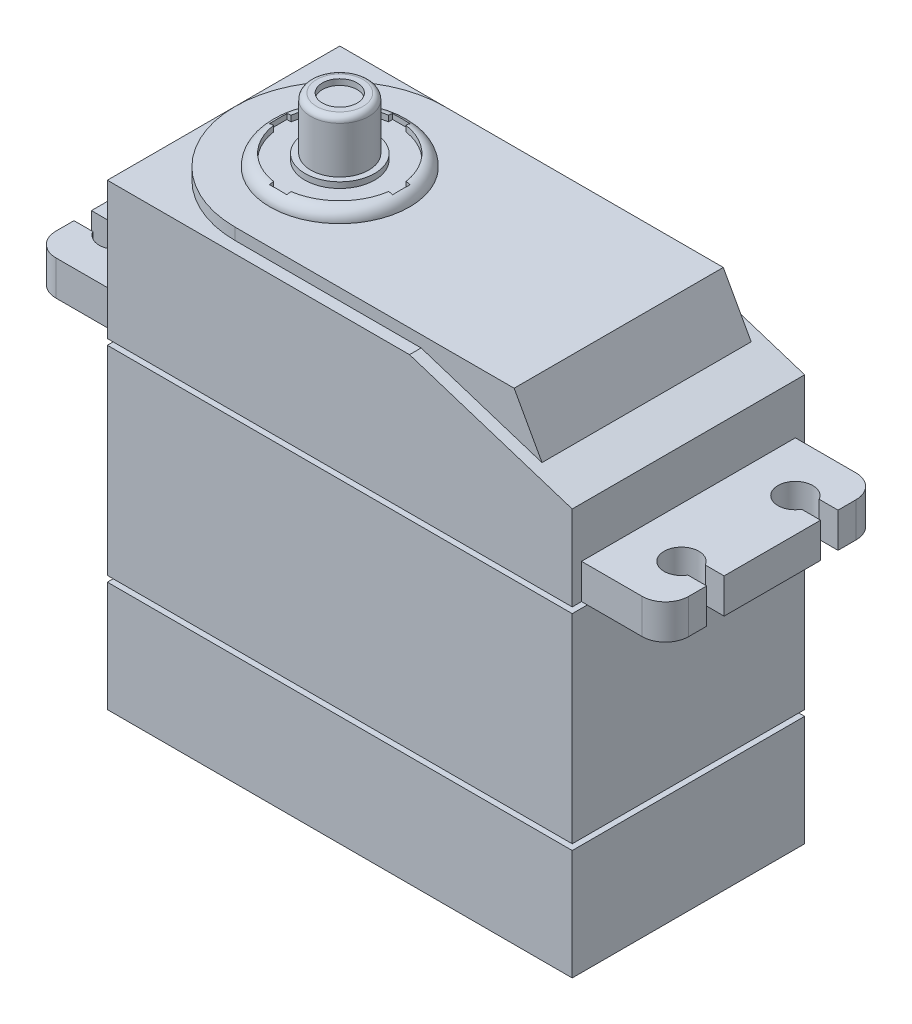
from build123d import *

# Parameters (mm, degrees)
SKETCH_1_W          = 40
SKETCH_1_H          = 20
EXTRUDE_1_DEPTH     = 40.45
EXTRUDE_2_DEPTH     = 3
FILLET_1_R          = 2
SKETCH_4_W          = 40
SKETCH_4_H          = 20
SKETCH_4_W_2        = 39
SKETCH_4_H_2        = 19
CUT_EXTRUDE_2_DEPTH = 0.5
SKETCH_5_W          = 40
SKETCH_5_H          = 20
SKETCH_5_W_2        = 39
SKETCH_5_H_2        = 19
CUT_EXTRUDE_3_DEPTH = 0.5
SKETCH_6_R          = 6
EXTRUDE_3_DEPTH     = 1
FILLET_2_R          = 1
SKETCH_7_R          = 5
SKETCH_7_R_2        = 3
SKETCH_7_R_3        = 2.5
CUT_EXTRUDE_4_DEPTH = 0.5
CUT_EXTRUDE_6_DEPTH = 1
CUT_EXTRUDE_7_DEPTH = 1
CUT_EXTRUDE_8_DEPTH = 54.103963207
EXTRUDE_START       = 5
SKETCH_11_R         = 2.5
EXTRUDE_4_DEPTH     = 5
SKETCH_12_R         = 1.5
CUT_EXTRUDE_9_DEPTH = 0.5
FILLET_3_R          = 0.5


with BuildPart() as part:
    # 草图1 → 凸台-拉伸1 (new body)
    with BuildSketch(Plane(origin=(0, 0, 0), x_dir=(1, 0, 0), z_dir=(0, 1, 0))):
        Rectangle(SKETCH_1_W, SKETCH_1_H)
    extrude(amount=EXTRUDE_1_DEPTH)

    # 草图2 → 凸台-拉伸2 (add)
    with BuildSketch(Plane(origin=(0, 27.65, 0), x_dir=(-1, 0, 0), z_dir=(0, -1, 0))):
        with BuildLine():
            Line((20, 9.2), (27.22, 9.2))
            Line((27.22, 9.2), (27.22, 5.65))
            Line((27.22, 5.65), (25.599038106, 5.65))
            ThreePointArc((25.599038106, 5.65), (22.8, 4.9), (25.599038106, 4.15))
            Line((25.599038106, 4.15), (27.22, 4.15))
            Line((27.22, 4.15), (27.22, -4.15))
            Line((27.22, -4.15), (25.599038106, -4.15))
            ThreePointArc((25.599038106, -4.15), (22.8, -4.9), (25.599038106, -5.65))
            Line((25.599038106, -5.65), (27.22, -5.65))
            Line((27.22, -5.65), (27.22, -9.2))
            Line((27.22, -9.2), (20, -9.2))
            Line((20, -9.2), (20, 9.2))
        make_face()
        with BuildLine():
            Line((-20, 9.2), (-20, -9.2))
            Line((-20, -9.2), (-27.22, -9.2))
            Line((-27.22, -9.2), (-27.22, -5.65))
            Line((-27.22, -5.65), (-25.599038106, -5.65))
            ThreePointArc((-25.599038106, -5.65), (-22.8, -4.9), (-25.599038106, -4.15))
            Line((-25.599038106, -4.15), (-27.22, -4.15))
            Line((-27.22, -4.15), (-27.22, 4.15))
            Line((-27.22, 4.15), (-25.599038106, 4.15))
            ThreePointArc((-25.599038106, 4.15), (-22.8, 4.9), (-25.599038106, 5.65))
            Line((-25.599038106, 5.65), (-27.22, 5.65))
            Line((-27.22, 5.65), (-27.22, 9.2))
            Line((-27.22, 9.2), (-20, 9.2))
        make_face()
    extrude(amount=-EXTRUDE_2_DEPTH)

    # 圆角1
    fillet_1_edges = [part.edges().sort_by_distance(p)[0] for p in [
        (-27.22, 29.15, -9.2),
        (-27.22, 29.15, 9.2),
        (27.22, 29.15, -9.2),
        (27.22, 29.15, 9.2),
    ]]
    fillet(fillet_1_edges, radius=FILLET_1_R)

    # 草图4 → 切除-拉伸2 (cut)
    with BuildSketch(Plane(origin=(0, 27.65, 0), x_dir=(-1, 0, 0), z_dir=(0, -1, 0))):
        Rectangle(SKETCH_4_W, SKETCH_4_H)
        Rectangle(SKETCH_4_W_2, SKETCH_4_H_2, mode=Mode.SUBTRACT)
    extrude(amount=CUT_EXTRUDE_2_DEPTH, mode=Mode.SUBTRACT)

    # 草图5 → 切除-拉伸3 (cut)
    with BuildSketch(Plane(origin=(0, 10, 0), x_dir=(-1, 0, 0), z_dir=(0, -1, 0))):
        Rectangle(SKETCH_5_W, SKETCH_5_H)
        Rectangle(SKETCH_5_W_2, SKETCH_5_H_2, mode=Mode.SUBTRACT)
    extrude(amount=CUT_EXTRUDE_3_DEPTH, mode=Mode.SUBTRACT)

    # 草图6 → 凸台-拉伸3 (add)
    with BuildSketch(Plane(origin=(0, 40.45, 0), x_dir=(1, 0, 0), z_dir=(0, 1, 0))):
        with Locations(Location((-10, 0, 0), (0, 0, 90))):
            Circle(SKETCH_6_R)
    extrude(amount=EXTRUDE_3_DEPTH)

    # 圆角2
    fillet_2_edges = [part.edges().sort_by_distance(p)[0] for p in [
        (-10, 41.45, 6),
    ]]
    fillet(fillet_2_edges, radius=FILLET_2_R - 0.0001)  # a hair under: the kernel refuses the full size

    # 草图7 → 切除-拉伸4 (cut)
    # profile 1 of 6: a face of its own
    with BuildSketch(Plane(origin=(0, 41.45, 0), x_dir=(1, 0, 0), z_dir=(0, 1, 0))):
        with Locations((-10, 0)):
            Circle(SKETCH_7_R)
        with Locations(Location((-10, 0, 0), (0, 0, 270))):
            Circle(SKETCH_7_R_2, mode=Mode.SUBTRACT)
    # profile 2 of 6: a face of its own
    with BuildSketch(Plane(origin=(0, 41.45, 0), x_dir=(1, 0, 0), z_dir=(0, 1, 0))):
        with BuildLine():
            Line((-14.943429983, 0.75), (-15.3, 0.75))
            Line((-15.3, 0.75), (-15.3, -0.75))
            Line((-15.3, -0.75), (-14.943429983, -0.75))
            ThreePointArc((-14.943429983, -0.75), (-15, 0), (-14.943429983, 0.75))
        make_face()
    # profile 3 of 6: a face of its own
    with BuildSketch(Plane(origin=(0, 41.45, 0), x_dir=(1, 0, 0), z_dir=(0, 1, 0))):
        with BuildLine():
            ThreePointArc((-9.25, -4.943429983), (-10, -5), (-10.75, -4.943429983))
            Line((-10.75, -4.943429983), (-10.75, -5.3))
            Line((-10.75, -5.3), (-9.25, -5.3))
            Line((-9.25, -5.3), (-9.25, -4.943429983))
        make_face()
    # profile 4 of 6: a face of its own
    with BuildSketch(Plane(origin=(0, 41.45, 0), x_dir=(1, 0, 0), z_dir=(0, 1, 0))):
        with BuildLine():
            Line((-4.7, 0.75), (-5.056570017, 0.75))
            ThreePointArc((-5.056570017, 0.75), (-5.014162562, 0.376065209), (-5, 0))
            ThreePointArc((-5, 0), (-5.014162562, -0.376065209), (-5.056570017, -0.75))
            Line((-5.056570017, -0.75), (-4.7, -0.75))
            Line((-4.7, -0.75), (-4.7, 0.75))
        make_face()
    # profile 5 of 6: a face of its own
    with BuildSketch(Plane(origin=(0, 41.45, 0), x_dir=(1, 0, 0), z_dir=(0, 1, 0))):
        with BuildLine():
            Line((-10.75, 5.3), (-10.75, 4.943429983))
            ThreePointArc((-10.75, 4.943429983), (-10, 5), (-9.25, 4.943429983))
            Line((-9.25, 4.943429983), (-9.25, 5.3))
            Line((-9.25, 5.3), (-10.75, 5.3))
        make_face()
    # profile 6 of 6: a face of its own
    with BuildSketch(Plane(origin=(0, 41.45, 0), x_dir=(1, 0, 0), z_dir=(0, 1, 0))):
        with Locations(Location((-10, 0, 0), (0, 0, 270))):
            Circle(SKETCH_7_R_3)
    extrude(amount=-CUT_EXTRUDE_4_DEPTH, mode=Mode.SUBTRACT)

    # 草图8 → 切除-拉伸6 (cut)
    with BuildSketch(Plane(origin=(0, 40.45, 0), x_dir=(1, 0, 0), z_dir=(0, 1, 0))):
        with BuildLine():
            Line((-10, 9), (20, 9))
            Line((20, 9), (20, 10))
            Line((20, 10), (-20, 10))
            Line((-20, 10), (-20, -10))
            Line((-20, -10), (20, -10))
            Line((20, -10), (20, -9))
            Line((20, -9), (-10, -9))
            ThreePointArc((-10, -9), (-19, 0), (-10, 9))
        make_face()
    extrude(amount=-CUT_EXTRUDE_6_DEPTH, mode=Mode.SUBTRACT)

    # 草图9 → 切除-拉伸7 (cut)
    with BuildSketch(Plane.XY.offset(10)):
        Polygon((6, 39.45), (20, 34.95), (20, 39.45), align=None)
    cut_extrude_7 = extrude(amount=-CUT_EXTRUDE_7_DEPTH, mode=Mode.SUBTRACT)

    # 镜向1: 切除-拉伸7 across plane
    add(cut_extrude_7.mirror(Plane.XY), mode=Mode.SUBTRACT)

    # 草图10 → 切除-拉伸8 (cut, through all)
    with BuildSketch(Plane.XY.offset(9)):
        Polygon((14, 40.45), (16.4, 36.107142857), (20, 34.95), (20, 40.45), align=None)
    extrude(amount=-CUT_EXTRUDE_8_DEPTH, mode=Mode.SUBTRACT)

    # 草图11 → 凸台-拉伸4 (add)
    with BuildSketch(Plane(origin=(0, 40.95, 0), x_dir=(1, 0, 0), z_dir=(0, 1, 0)).offset(EXTRUDE_START)):
        with Locations(Location((-10, 0, 0), (0, 0, 270))):
            Circle(SKETCH_11_R)
    extrude(amount=-EXTRUDE_4_DEPTH)

    # 草图12 → 切除-拉伸9 (cut)
    with BuildSketch(Plane(origin=(0, 45.95, 0), x_dir=(1, 0, 0), z_dir=(0, 1, 0))):
        with Locations(Location((-10, 0, 0), (0, 0, 270))):
            Circle(SKETCH_12_R)
    extrude(amount=-CUT_EXTRUDE_9_DEPTH, mode=Mode.SUBTRACT)

    # 圆角3
    fillet_3_edges = [part.edges().sort_by_distance(p)[0] for p in [
        (-10, 45.95, -2.5),
    ]]
    fillet(fillet_3_edges, radius=FILLET_3_R)


solid = part.part
